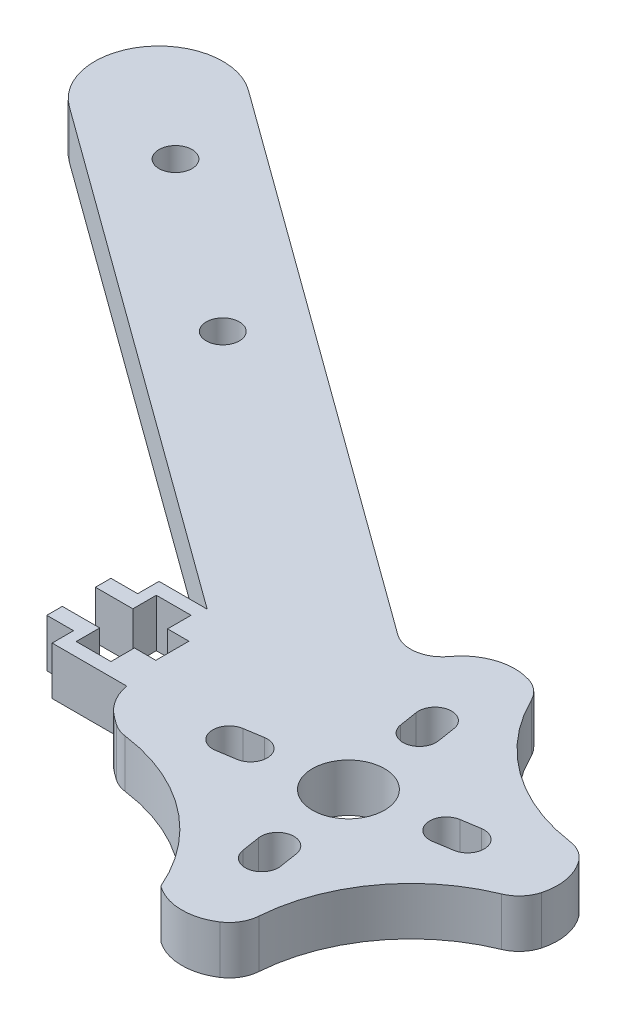
from build123d import *

# Parameters (mm, degrees)
SKETCH_3_R          = 3.375
SKETCH_3_R_2        = 1.55
EXTRUDE_1_DEPTH     = 4.5
FILLET_1_R          = 5
CUT_EXTRUDE_2_REACH = 154.257
FILLET_3_R          = 3


# Some blends are built 0.0001 mm under size
with BuildPart() as part:
    # 草图3 → 凸台-拉伸1 (new body)
    with BuildSketch(Plane(origin=(0, 0, 0), x_dir=(1, 0, 0), z_dir=(0, 1, 0))):
        with BuildLine():
            Line((41.866639538, -23.001486264), (95.429117628, -61.916904502))
            Line((95.429117628, -61.916904502), (100.131399646, -55.444768547))
            Line((100.131399646, -55.444768547), (122.783875489, -71.902755611))
            Line((122.783875489, -71.902755611), (106.325888424, -94.555231453))
            Line((106.325888424, -94.555231453), (83.673412582, -78.097244389))
            Line((83.673412582, -78.097244389), (84.470607294, -77))
            Line((84.470607294, -77), (82.009778971, -77))
            Line((82.009778971, -77), (77.5, -77))
            Line((77.5, -77), (77.5, -75))
            Line((77.5, -75), (75, -75))
            Line((75, -75), (75, -73.55))
            Line((75, -73.55), (78.5, -73.55))
            Line((78.5, -73.55), (78.5, -75.75))
            Line((78.5, -75.75), (81.75, -75.75))
            Line((81.75, -75.75), (81.75, -73.55))
            Line((81.75, -73.55), (83.75, -73.55))
            Line((83.75, -73.55), (83.75, -70.45))
            Line((83.75, -70.45), (81.75, -70.45))
            Line((81.75, -70.45), (81.75, -68.25))
            Line((81.75, -68.25), (78.5, -68.25))
            Line((78.5, -68.25), (78.5, -70.45))
            Line((78.5, -70.45), (75, -70.45))
            Line((75, -70.45), (75, -69))
            Line((75, -69), (77.5, -69))
            Line((77.5, -69), (77.5, -67))
            Line((77.5, -67), (82.009778971, -67))
            Line((82.009778971, -67), (34.81321651, -32.709690196))
            ThreePointArc((34.81321651, -32.709690196), (33.485826058, -24.328876716), (41.866639538, -23.001486264))
        make_face()
        with Locations(Location((103.228644035, -75, 0), (0, 0, 270))):
            Circle(SKETCH_3_R, mode=Mode.SUBTRACT)
        with Locations(Location((44.044221455, -32, 0), (0, 0, 270))):
            Circle(SKETCH_3_R_2, mode=Mode.SUBTRACT)
        with Locations(Location((60.224561343, -43.755705046, 0), (0, 0, 270))):
            Circle(SKETCH_3_R_2, mode=Mode.SUBTRACT)
        with BuildLine():
            Line((110.887677339, -72.217607352), (112.616131935, -71.943847038))
            ThreePointArc((112.616131935, -71.943847038), (114.389522284, -73.232290545), (113.101078777, -75.005680894))
            Line((113.101078777, -75.005680894), (111.372624181, -75.279441208))
            ThreePointArc((111.372624181, -75.279441208), (109.599233832, -73.9909977), (110.887677339, -72.217607352))
        make_face(mode=Mode.SUBTRACT)
        with BuildLine():
            Line((103.508085243, -66.856019854), (103.234324929, -65.127565258))
            ThreePointArc((103.234324929, -65.127565258), (101.46093458, -63.839121751), (100.172491073, -65.6125121))
            Line((100.172491073, -65.6125121), (100.446251387, -67.340966696))
            ThreePointArc((100.446251387, -67.340966696), (102.219641736, -68.629410203), (103.508085243, -66.856019854))
        make_face(mode=Mode.SUBTRACT)
        with BuildLine():
            Line((95.569610731, -77.782392648), (93.841156135, -78.056152962))
            ThreePointArc((93.841156135, -78.056152962), (92.067765787, -76.767709455), (93.356209294, -74.994319106))
            Line((93.356209294, -74.994319106), (95.08466389, -74.720558792))
            ThreePointArc((95.08466389, -74.720558792), (96.858054238, -76.0090023), (95.569610731, -77.782392648))
        make_face(mode=Mode.SUBTRACT)
        with BuildLine():
            Line((102.949202828, -83.143980146), (103.222963142, -84.872434742))
            ThreePointArc((103.222963142, -84.872434742), (104.99635349, -86.160878249), (106.284796997, -84.3874879))
            Line((106.284796997, -84.3874879), (106.011036684, -82.659033304))
            ThreePointArc((106.011036684, -82.659033304), (104.237646335, -81.370589797), (102.949202828, -83.143980146))
        make_face(mode=Mode.SUBTRACT)
    extrude(amount=EXTRUDE_1_DEPTH)

    # 圆角-美观1
    # the kernel refuses this fillet: 5 mm, written as the material it takes off along each edge
    with BuildSketch(Plane(origin=(83.673412582, -8.559797701, 78.097244389), x_dir=(0.5877852522924398, 0, -0.8090169943749717), z_dir=(0, 1, 0))) as fillet_1_piece_1:
        with BuildLine():
            CenterArc((5, -3.423919081), FILLET_1_R, 136.781392116, 43.218607884)
            Line((0, -3.423919081), (-0.1, -3.423919081))
            Line((-0.1, -3.423919081), (-0.1, 0))
            Line((-0.1, 0), (0, 0.1))
            ThreePointArc((0, 0.1), (0.678134326, 0.1), (1.283394026, 0.068478382))
            Line((1.283394026, 0.068478382), (1.356268653, 0))
        make_face()
    extrude(amount=21.619595403, mode=Mode.SUBTRACT)
    with BuildSketch(Plane(origin=(100.131399646, -12.5, 55.444768547), x_dir=(0.8090169943749468, 0, 0.5877852522924739), z_dir=(0, 1, 0)), Plane(origin=(122.783875489, -12.5, 71.902755611), x_dir=(-0.5877852522924745, 0, 0.8090169943749465), z_dir=(0, 1, 0)), Plane(origin=(106.325888424, -12.5, 94.555231453), x_dir=(-0.8090169943749468, 0, -0.5877852522924739), z_dir=(0, 1, 0))) as fillet_1_piece_2:
        with BuildLine():
            CenterArc((FILLET_1_R, -FILLET_1_R), FILLET_1_R, 90, 90)
            Line((0, -FILLET_1_R), (-FILLET_1_R * 0.02, -FILLET_1_R))
            Line((-FILLET_1_R * 0.02, -FILLET_1_R), (-FILLET_1_R * 0.02, FILLET_1_R * 0.02))
            Line((-FILLET_1_R * 0.02, FILLET_1_R * 0.02), (FILLET_1_R, FILLET_1_R * 0.02))
            Line((FILLET_1_R, FILLET_1_R * 0.02), (FILLET_1_R, 0))
        make_face()
    extrude(amount=29.5, mode=Mode.SUBTRACT)

    # 草图4 → 圆弧-美观2 (cut, up to next)
    with BuildSketch(Plane(origin=(0, 4.5, 0), x_dir=(1, 0, 0), z_dir=(0, 1, 0)), mode=Mode.PRIVATE) as cut_extrude_2_sk1:
        with BuildLine():
            Line((104.176484618, -58.383694808), (118.738790517, -68.963829349))
            ThreePointArc((118.738790517, -68.963829349), (109.994899962, -65.687047674), (104.176484618, -58.383694808))
        make_face()
    cut_extrude_2_tool1 = extrude(cut_extrude_2_sk1.sketch, amount=-CUT_EXTRUDE_2_REACH, mode=Mode.PRIVATE) & part.part
    # 草图4 → 圆弧-美观2 (cut, up to next)
    with BuildSketch(Plane(origin=(0, 4.5, 0), x_dir=(1, 0, 0), z_dir=(0, 1, 0)), mode=Mode.PRIVATE) as cut_extrude_2_sk2:
        with BuildLine():
            Line((119.844949227, -75.947840583), (109.264814686, -90.510146481))
            ThreePointArc((109.264814686, -90.510146481), (112.204348353, -81.521230905), (119.844949227, -75.947840583))
        make_face()
    cut_extrude_2_tool2 = extrude(cut_extrude_2_sk2.sketch, amount=-CUT_EXTRUDE_2_REACH, mode=Mode.PRIVATE) & part.part
    # 草图4 → 圆弧-美观2 (cut, up to next)
    with BuildSketch(Plane(origin=(0, 4.5, 0), x_dir=(1, 0, 0), z_dir=(0, 1, 0)), mode=Mode.PRIVATE) as cut_extrude_2_sk3:
        with BuildLine():
            Line((87.718497554, -81.036170651), (102.280803453, -91.616305192))
            ThreePointArc((102.280803453, -91.616305192), (96.462388109, -84.312952326), (87.718497554, -81.036170651))
        make_face()
    cut_extrude_2_tool3 = extrude(cut_extrude_2_sk3.sketch, amount=-CUT_EXTRUDE_2_REACH, mode=Mode.PRIVATE) & part.part
    add(cut_extrude_2_tool1.solids().sort_by_distance((110.868828, 4.5, 64.48419))[0], mode=Mode.SUBTRACT)
    add(cut_extrude_2_tool2.solids().sort_by_distance((113.606622, 4.5, 82.540042))[0], mode=Mode.SUBTRACT)
    add(cut_extrude_2_tool3.solids().sort_by_distance((95.58846, 4.5, 85.51581))[0], mode=Mode.SUBTRACT)

    # 圆角-美观3
    fillet_3_edges = [part.edges().sort_by_distance(p)[0] for p in [
        (104.176484618, 2.25, 58.383694808),
        (118.738790517, 2.25, 68.963829349),
        (119.844949227, 2.25, 75.947840583),
        (109.264814686, 2.25, 90.510146481),
        (95.429117628, 2.25, 61.916904502),
        (87.718497554, 2.25, 81.036170651),
    ]]
    fillet(fillet_3_edges, radius=FILLET_3_R - 0.0001)  # a hair under: the kernel refuses the full size


solid = part.part
